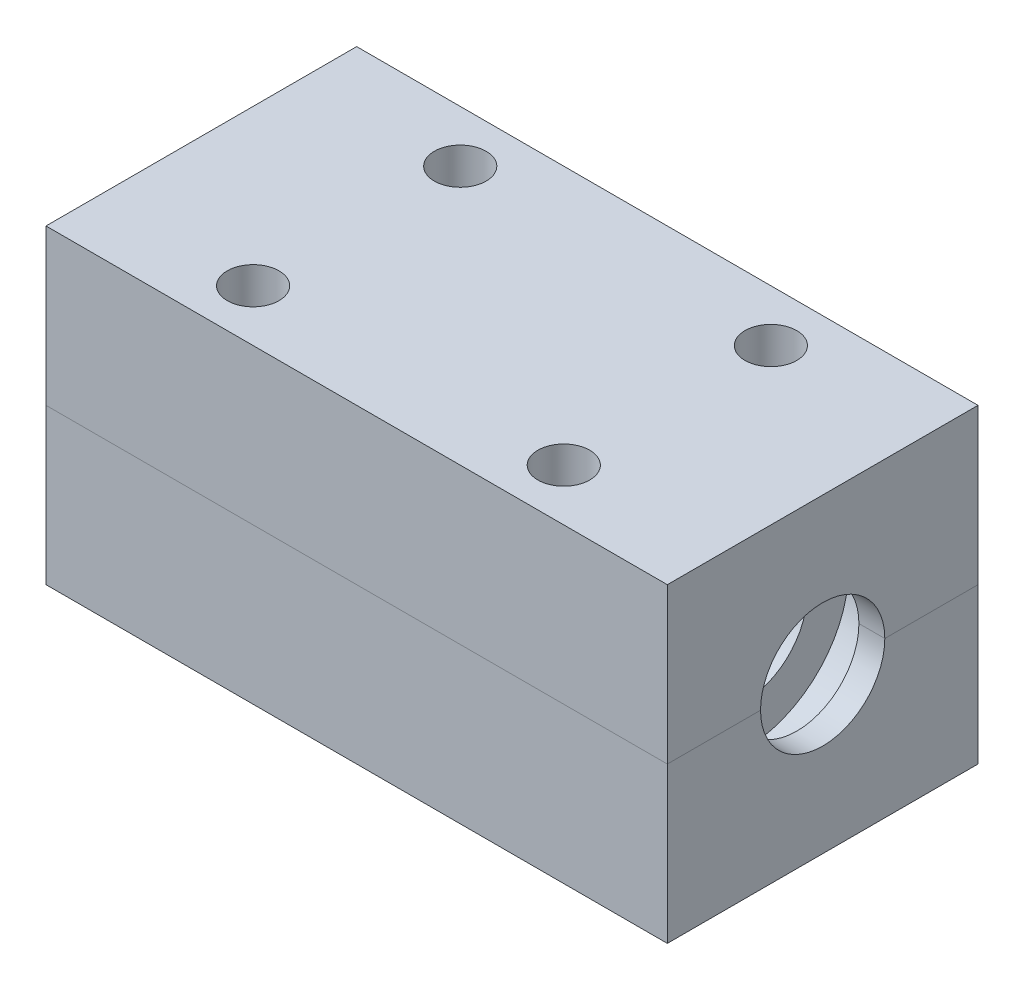
from build123d import *

# Parameters (mm, degrees)
SKETCH1_W           = 60
SKETCH1_H           = 30
SKETCH1_R           = 2.5
BOSS_EXTRUDE1_DEPTH = 30
SKETCH2_R           = 6
CUT_EXTRUDE1_DEPTH  = 74.484692283
CUT_EXTRUDE2_START  = -2.5
SKETCH2_4_R         = 10
SKETCH2_4_R_2       = 6
CUT_EXTRUDE2_DEPTH  = 5
SKETCH6_R           = 6
CUT_EXTRUDE5_DEPTH  = 15
CUT_EXTRUDE6_START  = -2.5
SKETCH6_3_R         = 10
CUT_EXTRUDE6_DEPTH  = 5


with BuildPart() as part:
    # Sketch1 → Boss-Extrude1 (new body)
    with BuildSketch(Plane(origin=(0, 0, 0), x_dir=(1, 0, 0), z_dir=(0, 1, 0))):
        with Locations((30, 15)):
            Rectangle(SKETCH1_W, SKETCH1_H)
        with Locations((45, 25)):
            Circle(SKETCH1_R, mode=Mode.SUBTRACT)
        with Locations((45, 5)):
            Circle(SKETCH1_R, mode=Mode.SUBTRACT)
        with Locations((15, 5)):
            Circle(SKETCH1_R, mode=Mode.SUBTRACT)
        with Locations((15, 25)):
            Circle(SKETCH1_R, mode=Mode.SUBTRACT)
    extrude(amount=BOSS_EXTRUDE1_DEPTH)

    # Sketch2 → Cut-Extrude1 (cut, through all)
    with BuildSketch(Plane.ZY):
        with Locations((-15, 15)):
            Circle(SKETCH2_R)
    extrude(amount=-CUT_EXTRUDE1_DEPTH, mode=Mode.SUBTRACT)

    # Sketch2<4> → Cut-Extrude2 (cut)
    with BuildSketch(Plane.ZY.offset(CUT_EXTRUDE2_START)):
        with Locations((-15, 15)):
            Circle(SKETCH2_4_R)
        with Locations((-15, 15)):
            Circle(SKETCH2_4_R_2, mode=Mode.SUBTRACT)
    cut_extrude2 = extrude(amount=-CUT_EXTRUDE2_DEPTH, mode=Mode.SUBTRACT)

    # Mirror1: Cut-Extrude2 across plane
    add(cut_extrude2.mirror(Plane.ZY.offset(-30)), mode=Mode.SUBTRACT)

    # Sketch6 → Cut-Extrude5 (cut)
    with BuildSketch(Plane(origin=(0, 0, -30), x_dir=(-1, 0, 0), z_dir=(0, 0, -1))):
        with Locations((-30, 15)):
            Circle(SKETCH6_R)
    extrude(amount=-CUT_EXTRUDE5_DEPTH, mode=Mode.SUBTRACT)

    # Sketch6<3> → Cut-Extrude6 (cut)
    with BuildSketch(Plane(origin=(0, 0, -30), x_dir=(-1, 0, 0), z_dir=(0, 0, -1)).offset(CUT_EXTRUDE6_START)):
        with Locations((-30, 15)):
            Circle(SKETCH6_3_R)
    extrude(amount=-CUT_EXTRUDE6_DEPTH, mode=Mode.SUBTRACT)


with BuildPart() as body_2:
    # Split2: the piece on the far side of the plane
    add(part.part)
    split(bisect_by=Plane(origin=(0, 15, 0), x_dir=(0, 0, -1), z_dir=(0, -1, 0)), keep=Keep.BOTTOM)


with BuildPart() as part_1:
    add(part.part)

    # Split2
    split(bisect_by=Plane(origin=(0, 15, 0), x_dir=(0, 0, -1), z_dir=(0, -1, 0)), keep=Keep.TOP)


solid = Compound([body_2.part, part_1.part])
